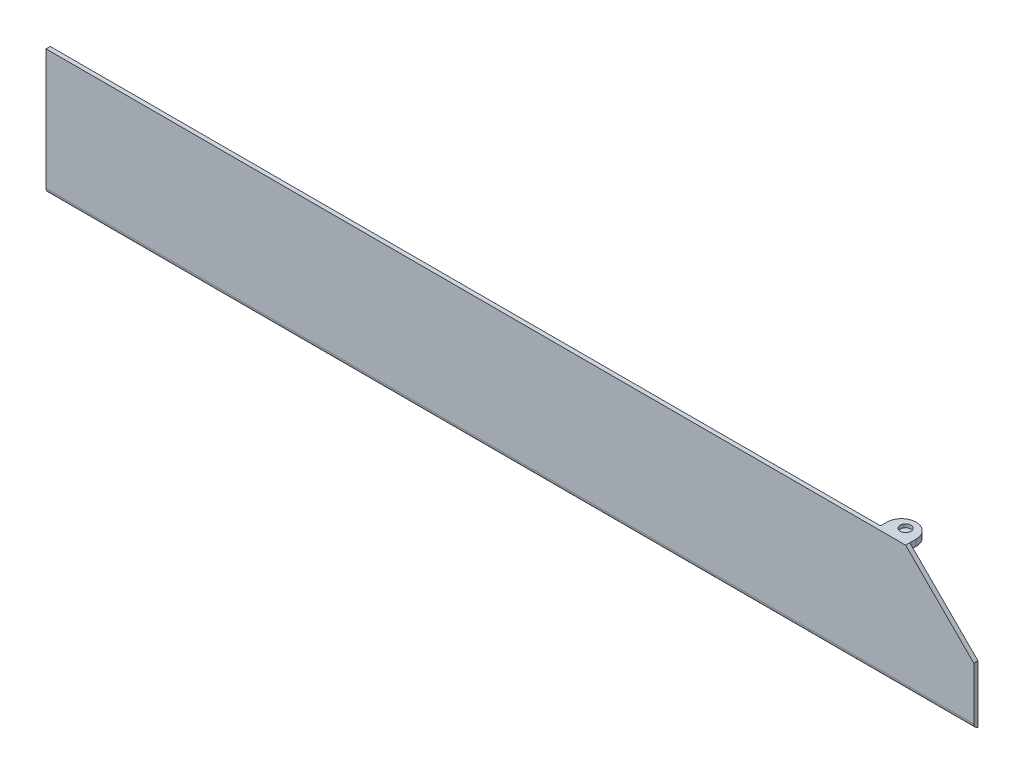
from build123d import *

# Parameters (mm, degrees)
BOSS_EXTRUDE1_DEPTH = 4
SKETCH2_W           = 5
SKETCH2_H           = 10
BOSS_EXTRUDE2_DEPTH = 20
SKETCH3_R           = 2.65
CUT_EXTRUDE1_DEPTH  = 20
FILLET1_R           = 5
SKETCH4_W           = 5
SKETCH4_H           = 10
BOSS_EXTRUDE3_DEPTH = 20
SKETCH5_R           = 2.65
CUT_EXTRUDE2_DEPTH  = 20
FILLET2_R           = 5
SKETCH6_W           = 28
SKETCH6_H           = 6
BOSS_EXTRUDE4_DEPTH = 20
SKETCH7_R           = 5.1
CUT_EXTRUDE3_DEPTH  = 3.2
FILLET3_R           = 14
FILLET4_R           = 5


# Some blends are built 0.0001 mm under size
with BuildPart() as part:
    # Sketch1 → Boss-Extrude1 (new body)
    with BuildSketch(Plane.XY):
        Polygon((0, 0), (885, 0), (885, 55), (820, 120), (0, 120), align=None)
    extrude(amount=BOSS_EXTRUDE1_DEPTH)

    # Sketch2 → Boss-Extrude2 (add)
    with BuildSketch(Plane(origin=(0, 0, 0), x_dir=(-1, 0, 0), z_dir=(0, 0, -1))):
        with Locations((-22.5, 90)):
            Rectangle(SKETCH2_W, SKETCH2_H)
        with Locations((-22.5, 35)):
            Rectangle(SKETCH2_W, SKETCH2_H)
    extrude(amount=BOSS_EXTRUDE2_DEPTH)

    # Sketch3 → Cut-Extrude1 (cut)
    with BuildSketch(Plane(origin=(25, 0, 0), x_dir=(0, 0, -1), z_dir=(1, 0, 0))):
        with Locations(Location((10, 90, 0), (0, 0, 90))):
            Circle(SKETCH3_R)
        with Locations(Location((10, 35, 0), (0, 0, 90))):
            Circle(SKETCH3_R)
    extrude(amount=-CUT_EXTRUDE1_DEPTH, mode=Mode.SUBTRACT)

    # Fillet1
    fillet1_edges = [part.edges().sort_by_distance(p)[0] for p in [
        (22.5, 30, -20),
        (22.5, 40, -20),
        (22.5, 85, -20),
        (22.5, 95, -20),
    ]]
    fillet(fillet1_edges, radius=FILLET1_R - 0.0001)  # a hair under: the kernel refuses the full size

    # Sketch4 → Boss-Extrude3 (add)
    with BuildSketch(Plane(origin=(0, 0, 0), x_dir=(-1, 0, 0), z_dir=(0, 0, -1))):
        with Locations((-862.5, 30)):
            Rectangle(SKETCH4_W, SKETCH4_H)
    extrude(amount=BOSS_EXTRUDE3_DEPTH)

    # Sketch5 → Cut-Extrude2 (cut)
    with BuildSketch(Plane(origin=(865, 0, 0), x_dir=(0, 0, -1), z_dir=(1, 0, 0))):
        with Locations((10, 30)):
            Circle(SKETCH5_R)
    extrude(amount=-CUT_EXTRUDE2_DEPTH, mode=Mode.SUBTRACT)

    # Fillet2
    fillet2_edges = [part.edges().sort_by_distance(p)[0] for p in [
        (862.5, 25, -20),
        (862.5, 35, -20),
    ]]
    fillet(fillet2_edges, radius=FILLET2_R - 0.0001)  # a hair under: the kernel refuses the full size

    # Sketch6 → Boss-Extrude4 (add)
    with BuildSketch(Plane(origin=(0, 0, 0), x_dir=(-1, 0, 0), z_dir=(0, 0, -1))):
        with Locations((-806, 117)):
            Rectangle(SKETCH6_W, SKETCH6_H)
    extrude(amount=BOSS_EXTRUDE4_DEPTH)

    # Sketch7 → Cut-Extrude3 (cut)
    with BuildSketch(Plane(origin=(0, 120, 0), x_dir=(1, 0, 0), z_dir=(0, 1, 0))):
        with Locations(Location((806, 10, 0), (0, 0, 180))):
            Circle(SKETCH7_R)
    extrude(amount=-CUT_EXTRUDE3_DEPTH, mode=Mode.SUBTRACT)

    # Fillet3
    fillet3_edges = [part.edges().sort_by_distance(p)[0] for p in [
        (792, 117, -20),
        (820, 117, -20),
    ]]
    fillet(fillet3_edges, radius=FILLET3_R - 0.0001)  # a hair under: the kernel refuses the full size

    # Fillet4
    # the kernel refuses this fillet: 5 mm, written as the material it takes off along each edge
    with BuildSketch(Plane(origin=(-12.247448714, 0, 4), x_dir=(0, 1, 0), z_dir=(1, 0, 0))) as fillet4_piece_1:
        with BuildLine():
            CenterArc((4.898979486, -5), FILLET4_R, 90, 78.463040967)
            Line((0, -4), (-0.09797959, -3.98))
            ThreePointArc((-0.09797959, -3.98), (-0.1, -2), (-0.1, 0))
            Line((-0.1, 0), (0, 0.1))
            Line((0, 0.1), (4.898979486, 0.1))
            Line((4.898979486, 0.1), (4.898979486, 0))
        make_face()
    extrude(amount=909.494897428, mode=Mode.SUBTRACT)


solid = part.part
